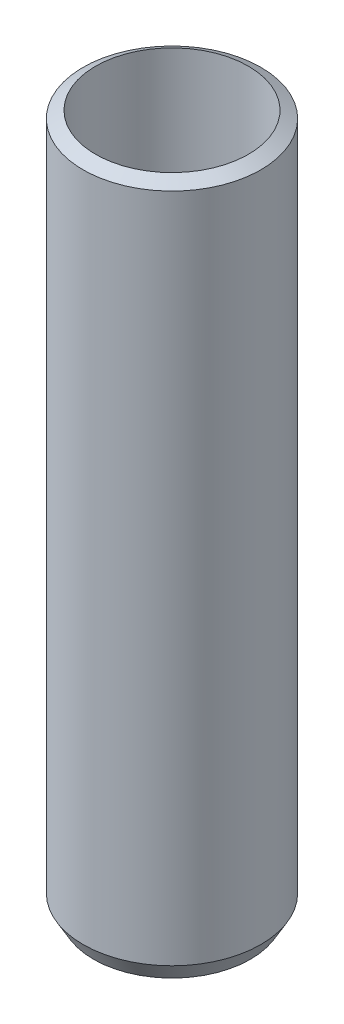
from build123d import *

# Parameters (mm, degrees)
SKETCH1_R           = 50
BOSS_EXTRUDE1_DEPTH = 393.46489
SKETCH2_R           = 42.993478796
CUT_EXTRUDE1_DEPTH  = 400.768207419
CHAMFER1_SIZE       = 5.846244
CHAMFER1_SIZE_2     = 10.125991


with BuildPart() as part:
    # Sketch1 → Boss-Extrude1 (new body)
    with BuildSketch(Plane(origin=(0, 0, 0), x_dir=(1, 0, 0), z_dir=(0, 1, 0))):
        with Locations(Location((0, 0, 0), (0, 0, 90))):
            Circle(SKETCH1_R)
    extrude(amount=BOSS_EXTRUDE1_DEPTH)

    # Sketch2 → Cut-Extrude1 (cut, through all)
    with BuildSketch(Plane(origin=(0, 0, 0), x_dir=(1, 0, 0), z_dir=(0, 1, 0))):
        with Locations(Location((0, 0, 0), (0, 0, 90))):
            Circle(SKETCH2_R)
    extrude(amount=CUT_EXTRUDE1_DEPTH, mode=Mode.SUBTRACT)

    # Chamfer1
    # the kernel refuses this chamfer: 10.125991, 5.846244 mm, written as the material it takes off along each edge
    with BuildSketch(Plane(origin=(0, 393.46489, 0), x_dir=(0, 0, -1), z_dir=(1, 0, 0))) as chamfer1_piece_1:
        Polygon((50, -CHAMFER1_SIZE), (50 - CHAMFER1_SIZE_2, 0), (50, 0), align=None)
    revolve(axis=Axis((0, 393.46489, 0), (0, 1, 0)), mode=Mode.SUBTRACT)
    with BuildSketch(Plane(origin=(0, 0, 0), x_dir=(0, 0, -1), z_dir=(1, 0, 0))) as chamfer1_piece_2:
        Polygon((50, CHAMFER1_SIZE_2), (50 - CHAMFER1_SIZE, 0), (50, 0), align=None)
    revolve(axis=Axis((0, 0, 0), (0, 1, 0)), mode=Mode.SUBTRACT)


solid = part.part
